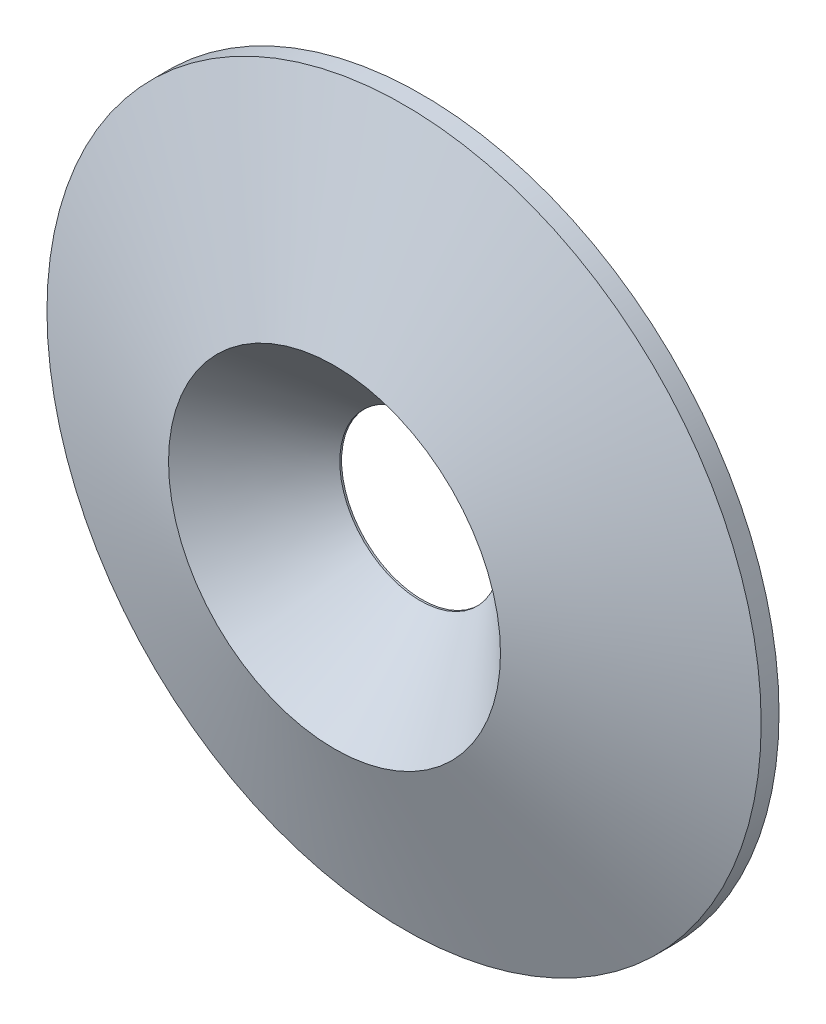
from build123d import *

# Parameters (mm, degrees)
SKETCH1_R           = 10
BOSS_EXTRUDE1_DEPTH = 2.5
CHAMFER1_SIZE       = 2
CHAMFER1_SIZE_2     = 5.494954839


with BuildPart() as part:
    # Sketch1 → Boss-Extrude1 (new body)
    with BuildSketch(Plane.XY):
        Circle(SKETCH1_R)
    extrude(amount=BOSS_EXTRUDE1_DEPTH)

    # Sketch3 → CSK for M4 Flat Head Machine Screw1 (revolve, cut)
    with BuildSketch(Plane(origin=(0, 0, 2.5), x_dir=(0, -1, 0), z_dir=(1, 0, 0))):
        Polygon((0, 0), (0, 2.5), (2.25, 2.5), (2.25, 2.45), (4.7, 0), align=None)
    revolve(axis=Axis((0, 0, 8.85), (0, 0, -1)), mode=Mode.SUBTRACT)

    # Chamfer1
    # the kernel refuses this chamfer: 5.494954839, 2 mm, written as the material it takes off along each edge
    with BuildSketch(Plane(origin=(0, 0, 2.5), x_dir=(1, 0, 0), z_dir=(0, -1, 0))) as chamfer1_piece_1:
        Polygon((10, -CHAMFER1_SIZE), (10 - CHAMFER1_SIZE_2, 0), (10, 0), align=None)
    revolve(axis=Axis((0, 0, 2.5), (0, 0, 1)), mode=Mode.SUBTRACT)


solid = part.part
